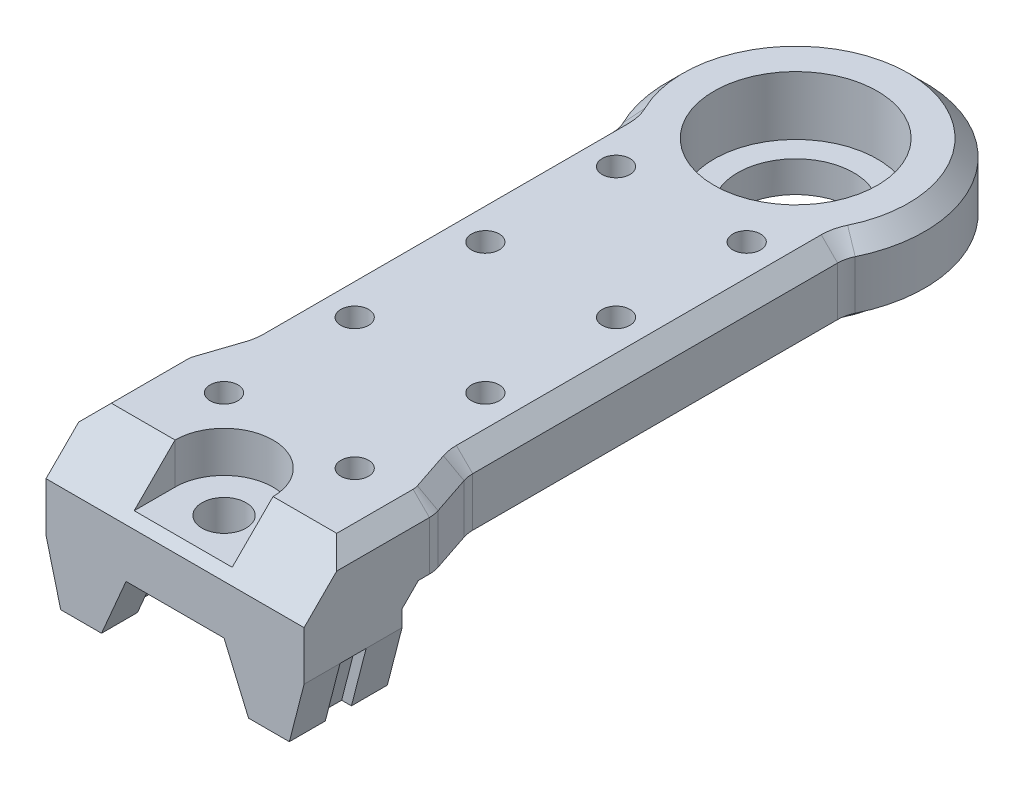
from build123d import *
from build123d.topology import SkipClean

# Parameters (mm, degrees)
EXTRUDE_1_DEPTH        = 4
EXTRUDE_3_DEPTH        = 6
CHAMFER_1_SIZE         = 3
SKETCH_5_R             = 0.85
CUT_EXTRUDE_1_DEPTH    = 4
PATTERN_LINEAR_1_COUNT = 4
PATTERN_LINEAR_1_PITCH = 8
CUT_EXTRUDE_2_DEPTH    = 2.5
CUT_EXTRUDE_3_REACH    = 41.439
SKETCH_7_R             = 1.35
SKETCH_8_R             = 6
EXTRUDE_4_DEPTH        = 1.5
FILLET_1_R             = 0.5
SKETCH_9_R             = 5
CUT_EXTRUDE_4_DEPTH    = 3.6
SKETCH_10_R            = 3.55
CUT_EXTRUDE_5_DEPTH    = 3.6
CUT_EXTRUDE_6_DEPTH    = 0.8
CUT_EXTRUDE_7_DEPTH    = 40.958228189
FILLET_2_R             = 2
CHAMFER_2_SIZE         = 1


with BuildPart() as part:
    # ｽｹｯﾁ1 → ﾎﾞｽ - 押し出し1 (new body)
    with BuildSketch(Plane(origin=(0, 0, 0), x_dir=(1, 0, 0), z_dir=(0, 1, 0))):
        with BuildLine():
            Line((-7.9, 0), (-7.9, -38))
            Line((-7.9, -38), (7.9, -38))
            Line((7.9, -38), (7.9, 0))
            ThreePointArc((7.9, 0), (0, 7.9), (-7.9, 0))
        make_face()
    extrude(amount=EXTRUDE_1_DEPTH)

    # ｽｹｯﾁ4 → ﾎﾞｽ - 押し出し3 (add)
    with BuildSketch(Plane.XY.offset(38)):
        Polygon((-7, -5.5), (-4.5, -5.5), (-3, -2), (3, -2), (4.5, -5.5), (7, -5.5), (7.9, -2), (7.9, 0), (-7.9, 0), (-7.9, -2), align=None)
    extrude(amount=-EXTRUDE_3_DEPTH)

    # 面取り1
    chamfer_1_edges = [part.edges().sort_by_distance(p)[0] for p in [
        (0, 4, 38),
    ]]
    chamfer(chamfer_1_edges, length=CHAMFER_1_SIZE)

    # ｽｹｯﾁ5 → ｶｯﾄ - 押し出し1 (cut)
    with BuildSketch(Plane(origin=(0, 4, 0), x_dir=(1, 0, 0), z_dir=(0, 1, 0))):
        with Locations(Location((-4, -31, 0), (0, 0, 270))):
            Circle(SKETCH_5_R)
        with Locations(Location((4, -31, 0), (0, 0, 270))):
            Circle(SKETCH_5_R)
    cut_extrude_1 = extrude(amount=-CUT_EXTRUDE_1_DEPTH, mode=Mode.SUBTRACT)

    # 直線ﾊﾟﾀｰﾝ1: ｶｯﾄ - 押し出し1 ×4
    with Locations(*[(0, 0, -i * PATTERN_LINEAR_1_PITCH) for i in range(1, PATTERN_LINEAR_1_COUNT)]):
        add(cut_extrude_1, mode=Mode.SUBTRACT)

    # ｽｹｯﾁ6 → ｶｯﾄ - 押し出し2 (cut)
    with BuildSketch(Plane(origin=(0, 4, 0), x_dir=(1, 0, 0), z_dir=(0, 1, 0))):
        with BuildLine():
            Line((-3, -35), (-3, -39))
            Line((-3, -39), (3, -39))
            Line((3, -39), (3, -35))
            ThreePointArc((3, -35), (0, -32), (-3, -35))
        make_face()
    extrude(amount=-CUT_EXTRUDE_2_DEPTH, mode=Mode.SUBTRACT)

    # ｽｹｯﾁ7 → ｶｯﾄ - 押し出し3 (cut, up to next)
    with BuildSketch(Plane(origin=(0, 1.5, 0), x_dir=(1, 0, 0), z_dir=(0, 1, 0)), mode=Mode.PRIVATE) as cut_extrude_3_sk1:
        with Locations(Location((0, -35, 0), (0, 0, 270))):
            Circle(SKETCH_7_R)
    cut_extrude_3_tool1 = extrude(cut_extrude_3_sk1.sketch, amount=-CUT_EXTRUDE_3_REACH, mode=Mode.PRIVATE) & part.part
    add(cut_extrude_3_tool1.solids().sort_by_distance((0, 1.5, 35))[0], mode=Mode.SUBTRACT)

    # ｽｹｯﾁ8 → ﾎﾞｽ - 押し出し4 (add)
    with BuildSketch(Plane.XZ):
        with Locations(Location((0, 0, 0), (0, 0, 90))):
            Circle(SKETCH_8_R)
    extrude(amount=EXTRUDE_4_DEPTH)

    # ﾌｨﾚｯﾄ1
    fillet_1_edges = [part.edges().sort_by_distance(p)[0] for p in [
        (0, 0, -6),
    ]]
    fillet(fillet_1_edges, radius=FILLET_1_R)

    # ｽｹｯﾁ9 → ｶｯﾄ - 押し出し4 (cut)
    with BuildSketch(Plane(origin=(0, 4, 0), x_dir=(1, 0, 0), z_dir=(0, 1, 0))):
        with Locations(Location((0, 0, 0), (0, 0, 270))):
            Circle(SKETCH_9_R)
    extrude(amount=-CUT_EXTRUDE_4_DEPTH, mode=Mode.SUBTRACT)

    # ｽｹｯﾁ10 → ｶｯﾄ - 押し出し5 (cut)
    with BuildSketch(Plane(origin=(0, 0.4, 0), x_dir=(1, 0, 0), z_dir=(0, 1, 0))):
        with Locations(Location((0, 0, 0), (0, 0, 270))):
            Circle(SKETCH_10_R)
    extrude(amount=-CUT_EXTRUDE_5_DEPTH, mode=Mode.SUBTRACT)

    # ｽｹｯﾁ11 → ｶｯﾄ - 押し出し6 (cut, symmetric)
    with BuildSketch(Plane.XY.offset(35)):
        Polygon((3, -2), (4.5, -5.5), (5.1, -5.5), (3.6, -2), align=None)
        Polygon((7.9, -2), (7, -5.5), (6.4, -5.5), (7.3, -2), align=None)
    cut_extrude_6 = extrude(amount=CUT_EXTRUDE_6_DEPTH, both=True, mode=Mode.SUBTRACT)

    # ﾐﾗｰ1: ｶｯﾄ - 押し出し6 across plane
    add(cut_extrude_6.mirror(Plane(origin=(0, 0, 0), x_dir=(0, 0, 1), z_dir=(1, 0, 0))), mode=Mode.SUBTRACT)

    # ｽｹｯﾁ12 → ｶｯﾄ - 押し出し7 (cut, through all)
    with SkipClean():  # the faces are left unmerged after this step: merging them gives an invalid solid
        with BuildSketch(Plane(origin=(0, 4, 0), x_dir=(1, 0, 0), z_dir=(0, 1, 0))):
            with BuildLine():
                Line((-7.9, 0), (-7.9, -30))
                Line((-7.9, -30), (-6.9, -27))
                Line((-6.9, -27), (-6.9, -3.847076812))
                ThreePointArc((-6.9, -3.847076812), (-7.645913941, -1.987460691), (-7.9, 0))
            make_face()
        cut_extrude_7 = extrude(amount=-CUT_EXTRUDE_7_DEPTH, mode=Mode.SUBTRACT)

    # ﾐﾗｰ2: ｶｯﾄ - 押し出し7 across plane
    with SkipClean():  # the faces are left unmerged after this step: merging them gives an invalid solid
        add(cut_extrude_7.mirror(Plane(origin=(0, 0, 0), x_dir=(0, 0, 1), z_dir=(1, 0, 0))), mode=Mode.SUBTRACT)

    # ﾌｨﾚｯﾄ2
    fillet_2_edges = [part.edges().sort_by_distance(p)[0] for p in [
        (-6.9, 2, 3.847076812),
        (-6.9, 2, 27),
        (-7.9, 2, 30),
        (6.9, 2, 3.847076812),
        (7.9, 2, 30),
        (6.9, 2, 27),
    ]]
    fillet(fillet_2_edges, radius=FILLET_2_R)

    # 面取り2
    # the kernel refuses this chamfer: 1 mm, written as the material it adds along each edge
    with BuildSketch(Plane(origin=(7.9, 0, 32), x_dir=(0, 0.02749587661058639, -0.9996219169112968), z_dir=(-1, 0, 0))) as chamfer_2_piece_1_section:
        Polygon((CHAMFER_2_SIZE * 0.999621916911, CHAMFER_2_SIZE * 0.0274958766106), (-CHAMFER_2_SIZE * 0.0274958766106, CHAMFER_2_SIZE * 0.999621916911), (0, 0), align=None)
    chamfer_2_piece_1 = extrude(amount=15.8, mode=Mode.PRIVATE)
    chamfer_2_piece_1 = chamfer_2_piece_1 - Plane(origin=(-4, -0.34097177, 31), x_dir=(0, 0, 1), z_dir=(0, 1, 0)) * Cylinder(0.85, 36, mode=Mode.PRIVATE)
    chamfer_2_piece_1 = chamfer_2_piece_1 - Plane(origin=(4, -0.34097177, 31), x_dir=(0, 0, 1), z_dir=(0, 1, 0)) * Cylinder(0.85, 36, mode=Mode.PRIVATE)
    add(chamfer_2_piece_1)
    # the kernel refuses this chamfer: 1 mm, written as the material it takes off along each edge
    with BuildSketch(Plane(origin=(-7.9, 4, 30.32455532), x_dir=(-0.027495876610586487, -0.9996219169112968, 0), z_dir=(0, 0, 1)), Plane(origin=(7.9, 4, 37.571682988), x_dir=(0.027495876610586487, -0.9996219169112968, 0), z_dir=(0, 0, -1))) as chamfer_2_2_piece_1:
        Polygon((CHAMFER_2_SIZE * 0.999621916911, CHAMFER_2_SIZE * 0.0274958766106), (-CHAMFER_2_SIZE * 0.0274958766106, CHAMFER_2_SIZE * 0.999621916911), (0, 0), align=None)
    extrude(amount=7.247127668, mode=Mode.SUBTRACT)
    with BuildSketch(Plane(origin=(0, 4, 0), x_dir=(1, 0, 0), z_dir=(0, 0, 1))) as chamfer_2_2_piece_2:
        Polygon((7.9, -CHAMFER_2_SIZE), (7.9 - CHAMFER_2_SIZE, 0), (7.9, 0), align=None)
    revolve(axis=Axis((0, 4, 0), (0, 1, 0)), revolution_arc=180, mode=Mode.SUBTRACT)
    with BuildSketch(Plane(origin=(-5.9, 4, 30.32455532), x_dir=(-1, 0, 0), z_dir=(0, 0, 1))) as chamfer_2_2_piece_3:
        Polygon((2, CHAMFER_2_SIZE), (2 - CHAMFER_2_SIZE, 0), (2, 0), align=None)
    revolve(axis=Axis((-5.9, 4, 30.32455532), (0, -1, 0)), revolution_arc=18.434948823, mode=Mode.SUBTRACT)
    with BuildSketch(Plane(origin=(-7.797366596, 4, 29.692099788), x_dir=(-0.02608487890572092, -0.9996219169112968, -0.008694959635240314), z_dir=(0.3162277660168382, 0, -0.9486832980505138))) as chamfer_2_2_piece_4:
        Polygon((CHAMFER_2_SIZE * 0.999621916911, -CHAMFER_2_SIZE * 0.0274958766106), (-CHAMFER_2_SIZE * 0.0274958766106, -CHAMFER_2_SIZE * 0.999621916911), (0, 0), align=None)
    extrude(amount=2.513167019, mode=Mode.SUBTRACT)
    with BuildSketch(Plane(origin=(-8.9, 4, 26.67544468), x_dir=(0.9486832980505135, 0, 0.3162277660168389), z_dir=(-0.3162277660168389, 0, 0.9486832980505135))) as chamfer_2_2_piece_5:
        Polygon((2, -CHAMFER_2_SIZE), (2 + CHAMFER_2_SIZE, 0), (2, 0), align=None)
    revolve(axis=Axis((-8.9, 4, 26.67544468), (0, 1, 0)), revolution_arc=18.434948823, mode=Mode.SUBTRACT)
    with BuildSketch(Plane(origin=(-6.9, 4, 26.67544468), x_dir=(-0.027495876610586487, -0.9996219169112968, 0), z_dir=(0, 0, -1))) as chamfer_2_2_piece_6:
        Polygon((CHAMFER_2_SIZE * 0.999621916911, -CHAMFER_2_SIZE * 0.0274958766106), (-CHAMFER_2_SIZE * 0.0274958766106, -CHAMFER_2_SIZE * 0.999621916911), (0, 0), align=None)
    extrude(amount=22.339548002, mode=Mode.SUBTRACT)
    with BuildSketch(Plane(origin=(-8.9, 4, 4.335896678), x_dir=(1, 0, 0), z_dir=(0, 0, 1))) as chamfer_2_2_piece_7:
        Polygon((2, -CHAMFER_2_SIZE), (2 + CHAMFER_2_SIZE, 0), (2, 0), align=None)
    revolve(axis=Axis((-8.9, 4, 4.335896678), (0, 1, 0)), revolution_arc=25.974390018, mode=Mode.SUBTRACT)
    with BuildSketch(Plane(origin=(8.9, 4, 4.335896678), x_dir=(-0.8989898989898989, 0, -0.43796936138745074), z_dir=(0.43796936138745074, 0, -0.8989898989898989))) as chamfer_2_2_piece_8:
        Polygon((2, -CHAMFER_2_SIZE), (2 + CHAMFER_2_SIZE, 0), (2, 0), align=None)
    revolve(axis=Axis((8.9, 4, 4.335896678), (0, 1, 0)), revolution_arc=25.974390018, mode=Mode.SUBTRACT)
    with BuildSketch(Plane(origin=(6.9, 4, 26.67544468), x_dir=(0.027495876610586487, -0.9996219169112968, 0), z_dir=(0, 0, -1))) as chamfer_2_2_piece_9:
        Polygon((CHAMFER_2_SIZE * 0.999621916911, CHAMFER_2_SIZE * 0.0274958766106), (-CHAMFER_2_SIZE * 0.0274958766106, CHAMFER_2_SIZE * 0.999621916911), (0, 0), align=None)
    extrude(amount=22.339548002, mode=Mode.SUBTRACT)
    with BuildSketch(Plane(origin=(8.9, 4, 26.67544468), x_dir=(-1, 0, 0), z_dir=(0, 0, -1))) as chamfer_2_2_piece_10:
        Polygon((2, -CHAMFER_2_SIZE), (2 + CHAMFER_2_SIZE, 0), (2, 0), align=None)
    revolve(axis=Axis((8.9, 4, 26.67544468), (0, 1, 0)), revolution_arc=18.434948823, mode=Mode.SUBTRACT)
    with BuildSketch(Plane(origin=(7.797366596, 4, 29.692099788), x_dir=(0.02608487890572092, -0.9996219169112968, -0.008694959635240314), z_dir=(-0.3162277660168382, 0, -0.9486832980505138))) as chamfer_2_2_piece_11:
        Polygon((CHAMFER_2_SIZE * 0.999621916911, CHAMFER_2_SIZE * 0.0274958766106), (-CHAMFER_2_SIZE * 0.0274958766106, CHAMFER_2_SIZE * 0.999621916911), (0, 0), align=None)
    extrude(amount=2.513167019, mode=Mode.SUBTRACT)
    with BuildSketch(Plane(origin=(5.9, 4, 30.32455532), x_dir=(0.9486832980505135, 0, -0.3162277660168389), z_dir=(-0.3162277660168389, 0, -0.9486832980505135))) as chamfer_2_2_piece_12:
        Polygon((2, CHAMFER_2_SIZE), (2 - CHAMFER_2_SIZE, 0), (2, 0), align=None)
    revolve(axis=Axis((5.9, 4, 30.32455532), (0, -1, 0)), revolution_arc=18.434948823, mode=Mode.SUBTRACT)
    with BuildSketch(Plane(origin=(0, 4, 0), x_dir=(0.8989898989898987, 0, 0.43796936138745124), z_dir=(-0.43796936138745124, 0, 0.8989898989898987))) as chamfer_2_2_piece_13:
        Polygon((7.9, -CHAMFER_2_SIZE), (7.9 - CHAMFER_2_SIZE, 0), (7.9, 0), align=None)
    revolve(axis=Axis((0, 4, 0), (0, 1, 0)), revolution_arc=25.974390018, mode=Mode.SUBTRACT)
    with BuildSketch(Plane(origin=(0, 4, 0), x_dir=(-0.8989898989898987, 0, 0.43796936138745124), z_dir=(0.43796936138745124, 0, 0.8989898989898987))) as chamfer_2_2_piece_14:
        Polygon((7.9, CHAMFER_2_SIZE), (7.9 - CHAMFER_2_SIZE, 0), (7.9, 0), align=None)
    revolve(axis=Axis((0, 4, 0), (0, -1, 0)), revolution_arc=25.974390018, mode=Mode.SUBTRACT)


solid = part.part
